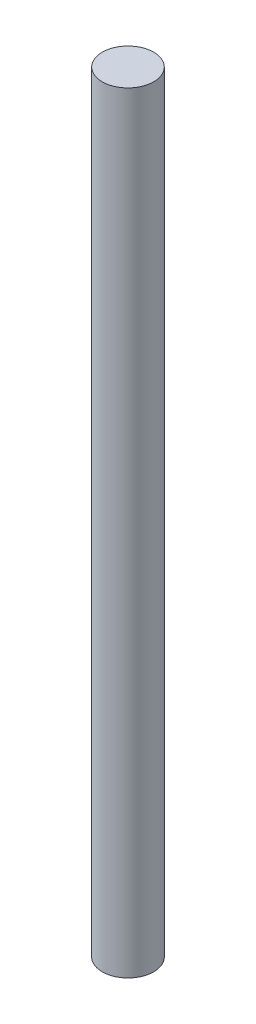
from build123d import *

# Parameters (mm, degrees)
SKETCH1_R           = 12.7
BOSS_EXTRUDE1_DEPTH = 381


with BuildPart() as part:
    # Sketch1 → Boss-Extrude1 (new body)
    with BuildSketch(Plane(origin=(0, 0, 0), x_dir=(1, 0, 0), z_dir=(0, 1, 0))):
        Circle(SKETCH1_R)
    extrude(amount=BOSS_EXTRUDE1_DEPTH)


solid = part.part
